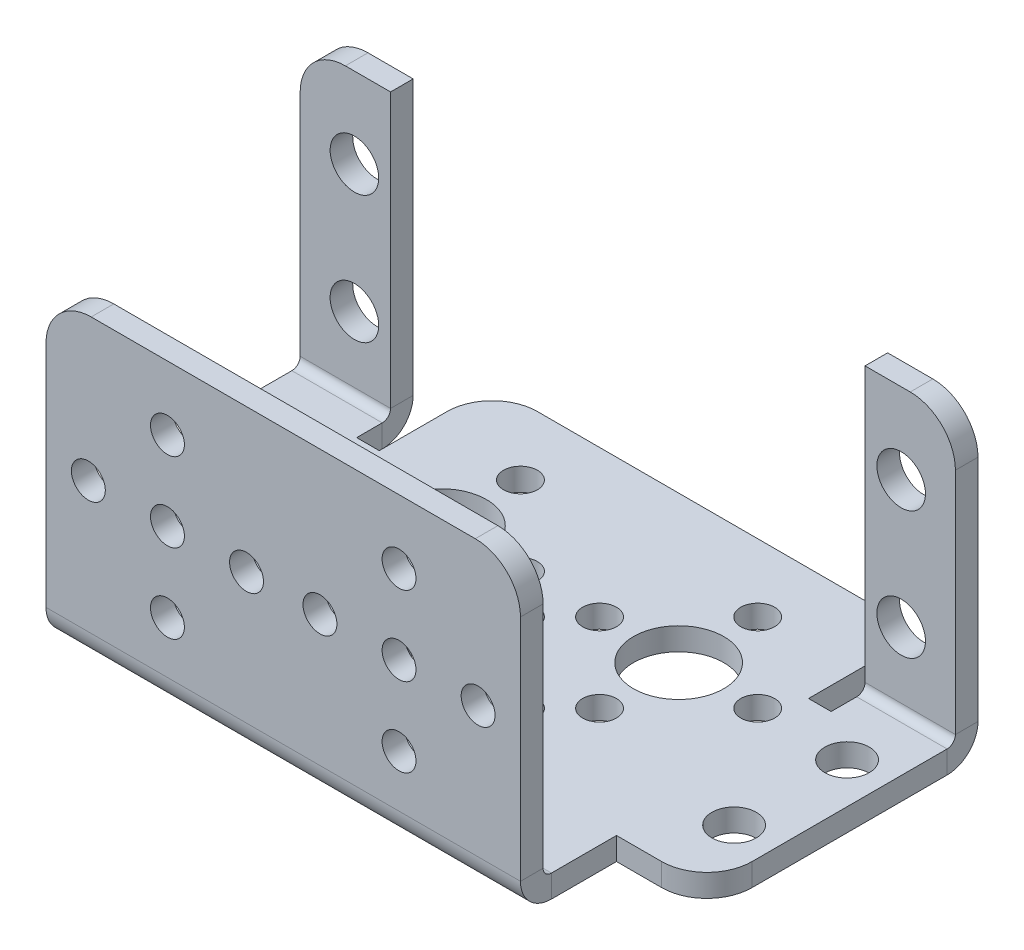
from build123d import *

# Parameters (mm, degrees)
SKETCH2_R                    = 1.9668129
SKETCH2_R_2                  = 4
SKETCH2_R_3                  = 1.5
BASE_FLANGE1_DEPTH           = 2
FILLET1_R                    = 4
EDGE_FLANGE1_STRIP_W         = 9.4732
EDGE_FLANGE1_STRIP_H         = 2
EDGE_FLANGE1_STRIP_CUT_DEPTH = 8
EDGE_FLANGE1_DEPTH           = 8
EDGE_FLANGE2_STRIP_W         = 9.4732
EDGE_FLANGE2_STRIP_H         = 2
EDGE_FLANGE2_STRIP_CUT_DEPTH = 8
EDGE_FLANGE2_DEPTH           = 8
EDGE_FLANGE3_STRIP_W         = 9.4732
EDGE_FLANGE3_STRIP_H         = 2
EDGE_FLANGE3_STRIP_CUT_DEPTH = 42
EDGE_FLANGE3_DEPTH           = 42
FILLET2_R                    = 4
FILLET3_R                    = 4
SKETCH16_R                   = 2.15
SKETCH16_R_2                 = 1.5
CUT_EXTRUDE1_DEPTH           = 54.593376456


# Sheet-metal steps are written as plain solids
with BuildPart() as part:
    # Sketch2 → Base-Flange1 (new body)
    with BuildSketch(Plane(origin=(0, 0, 0), x_dir=(1, 0, 0), z_dir=(0, 1, 0))):
        Polygon((-21, 12.815864023), (-29, 12.815864023), (-29, -9.184135977), (-21, -9.184135977), (-21, -15.684135977), (21, -15.684135977), (21, -9.184135977), (29, -9.184135977), (29, 12.815864023), (21, 12.815864023), (21, 9.815864023), (19, 9.815864023), (19, 19.815864023), (-19, 19.815864023), (-19, 9.815864023), (-21, 9.815864023), align=None)
        with Locations(Location((-25, -3.184135977, 0), (0, 0, 270))):
            Circle(SKETCH2_R, mode=Mode.SUBTRACT)
        with Locations(Location((-25, 6.815864023, 0), (0, 0, 270))):
            Circle(SKETCH2_R, mode=Mode.SUBTRACT)
        with Locations(Location((25.409668555, 6.815864023, 0), (0, 0, 270))):
            Circle(SKETCH2_R, mode=Mode.SUBTRACT)
        with Locations(Location((25.409668555, -3.184135977, 0), (0, 0, 270))):
            Circle(SKETCH2_R, mode=Mode.SUBTRACT)
        with Locations(Location((-10.5, 6.815864023, 0), (0, 0, 270))):
            Circle(SKETCH2_R_2, mode=Mode.SUBTRACT)
        with Locations(Location((10.5, 6.815864023, 0), (0, 0, 270))):
            Circle(SKETCH2_R_2, mode=Mode.SUBTRACT)
        with Locations(Location((0, -3.684135977, 0), (0, 0, 270))):
            Circle(SKETCH2_R_2, mode=Mode.SUBTRACT)
        with Locations(Location((-10.5, 13.815864023, 0), (0, 0, 270))):
            Circle(SKETCH2_R_3, mode=Mode.SUBTRACT)
        with Locations(Location((10.5, 13.815864023, 0), (0, 0, 270))):
            Circle(SKETCH2_R_3, mode=Mode.SUBTRACT)
        with Locations(Location((0, -10.684135977, 0), (0, 0, 270))):
            Circle(SKETCH2_R_3, mode=Mode.SUBTRACT)
        with Locations(Location((-3.5, 6.815864023, 0), (0, 0, 270))):
            Circle(SKETCH2_R_3, mode=Mode.SUBTRACT)
        with Locations(Location((-10.5, -0.184135977, 0), (0, 0, 270))):
            Circle(SKETCH2_R_3, mode=Mode.SUBTRACT)
        with Locations(Location((-17.5, 6.815864023, 0), (0, 0, 270))):
            Circle(SKETCH2_R_3, mode=Mode.SUBTRACT)
        with Locations(Location((17.5, 6.815864023, 0), (0, 0, 270))):
            Circle(SKETCH2_R_3, mode=Mode.SUBTRACT)
        with Locations(Location((10.5, -0.184135977, 0), (0, 0, 270))):
            Circle(SKETCH2_R_3, mode=Mode.SUBTRACT)
        with Locations(Location((3.5, 6.815864023, 0), (0, 0, 270))):
            Circle(SKETCH2_R_3, mode=Mode.SUBTRACT)
        with Locations(Location((-7, -3.684135977, 0), (0, 0, 270))):
            Circle(SKETCH2_R_3, mode=Mode.SUBTRACT)
        with Locations(Location((0, 3.315864023, 0), (0, 0, 270))):
            Circle(SKETCH2_R_3, mode=Mode.SUBTRACT)
        with Locations(Location((7, -3.684135977, 0), (0, 0, 270))):
            Circle(SKETCH2_R_3, mode=Mode.SUBTRACT)
    extrude(amount=-BASE_FLANGE1_DEPTH)

    # Fillet1
    fillet1_edges = [part.edges().sort_by_distance(p)[0] for p in [
        (-19, -1, -19.815864023),
        (19, -1, -19.815864023),
        (29, -1, 9.184135977),
        (-29, -1, 9.184135977),
    ]]
    fillet(fillet1_edges, radius=FILLET1_R)

    # Edge-Flange1 strip (across the edge) → Edge-Flange1 strip cut (cut)
    with BuildSketch(Plane(origin=(-21, 0, -12.815864023), x_dir=(0, 0, 1), z_dir=(-1, 0, 0))):
        with Locations((-4, -1)):
            Rectangle(EDGE_FLANGE1_STRIP_W, EDGE_FLANGE1_STRIP_H)
    extrude(amount=EDGE_FLANGE1_STRIP_CUT_DEPTH, mode=Mode.SUBTRACT)

    # Edge-Flange1 section (across the edge) → Edge-Flange1 (add)
    with BuildSketch(Plane(origin=(-21, 0, -12.815864023), x_dir=(0, 0, 1), z_dir=(-1, 0, 0))):
        with BuildLine():
            Line((-2, 0.7366), (-2, 25))
            Line((-2, 25), (0, 25))
            Line((0, 25), (0, 0.7366))
            ThreePointArc((0, 0.7366), (0.215745145, 0.215745145), (0.7366, 0))
            Line((0.7366, 0), (0.7366, -2))
            ThreePointArc((0.7366, -2), (-1.198468417, -1.198468417), (-2, 0.7366))
        make_face()
    extrude(amount=EDGE_FLANGE1_DEPTH)

    # Edge-Flange2 strip (across the edge) → Edge-Flange2 strip cut (cut)
    with BuildSketch(Plane(origin=(29, 0, -12.815864023), x_dir=(0, 0, 1), z_dir=(-1, 0, 0))):
        with Locations((-4, -1)):
            Rectangle(EDGE_FLANGE2_STRIP_W, EDGE_FLANGE2_STRIP_H)
    extrude(amount=EDGE_FLANGE2_STRIP_CUT_DEPTH, mode=Mode.SUBTRACT)

    # Edge-Flange2 section (across the edge) → Edge-Flange2 (add)
    with BuildSketch(Plane(origin=(29, 0, -12.815864023), x_dir=(0, 0, 1), z_dir=(-1, 0, 0))):
        with BuildLine():
            Line((-2, 0.7366), (-2, 25))
            Line((-2, 25), (0, 25))
            Line((0, 25), (0, 0.7366))
            ThreePointArc((0, 0.7366), (0.215745145, 0.215745145), (0.7366, 0))
            Line((0.7366, 0), (0.7366, -2))
            ThreePointArc((0.7366, -2), (-1.198468417, -1.198468417), (-2, 0.7366))
        make_face()
    extrude(amount=EDGE_FLANGE2_DEPTH)

    # Edge-Flange3 strip (across the edge) → Edge-Flange3 strip cut (cut)
    with BuildSketch(Plane(origin=(-21, 0, 15.684135977), x_dir=(0, 0, -1), z_dir=(1, 0, 0))):
        with Locations((-4, -1)):
            Rectangle(EDGE_FLANGE3_STRIP_W, EDGE_FLANGE3_STRIP_H)
    extrude(amount=EDGE_FLANGE3_STRIP_CUT_DEPTH, mode=Mode.SUBTRACT)

    # Edge-Flange3 section (across the edge) → Edge-Flange3 (add)
    with BuildSketch(Plane(origin=(-21, 0, 15.684135977), x_dir=(0, 0, -1), z_dir=(1, 0, 0))):
        with BuildLine():
            Line((-2, 0.7366), (-2, 25))
            Line((-2, 25), (0, 25))
            Line((0, 25), (0, 0.7366))
            ThreePointArc((0, 0.7366), (0.215745145, 0.215745145), (0.7366, 0))
            Line((0.7366, 0), (0.7366, -2))
            ThreePointArc((0.7366, -2), (-1.198468417, -1.198468417), (-2, 0.7366))
        make_face()
    extrude(amount=EDGE_FLANGE3_DEPTH)

    # Fillet2
    fillet2_edges = [part.edges().sort_by_distance(p)[0] for p in [
        (-29, 25, -13.815864023),
        (29, 25, -13.815864023),
    ]]
    fillet(fillet2_edges, radius=FILLET2_R)

    # Fillet3
    fillet3_edges = [part.edges().sort_by_distance(p)[0] for p in [
        (-21, 25, 16.684135977),
        (21, 25, 16.684135977),
    ]]
    fillet(fillet3_edges, radius=FILLET3_R)

    # Sketch16 → Cut-Extrude1 (cut, through all)
    with BuildSketch(Plane.XY.offset(17.684135977)):
        with Locations(Location((-24.2, 17.870640786, 0), (0, 0, 270))):
            Circle(SKETCH16_R)
        with Locations(Location((24.2, 17.870640786, 0), (0, 0, 270))):
            Circle(SKETCH16_R)
        with Locations(Location((-24.2, 6.570640786, 0), (0, 0, 270))):
            Circle(SKETCH16_R)
        with Locations(Location((24.2, 6.570640786, 0), (0, 0, 270))):
            Circle(SKETCH16_R)
        with Locations((-10.25, 12.330953146)):
            Circle(SKETCH16_R_2)
        with Locations((-10.25, 5.330953146)):
            Circle(SKETCH16_R_2)
        with Locations((10.25, 12.330953146)):
            Circle(SKETCH16_R_2)
        with Locations((10.25, 5.330953146)):
            Circle(SKETCH16_R_2)
        with Locations((-17.25, 12.330953146)):
            Circle(SKETCH16_R_2)
        with Locations((-10.25, 19.330953146)):
            Circle(SKETCH16_R_2)
        with Locations((-3.25, 12.330953146)):
            Circle(SKETCH16_R_2)
        with Locations((3.25, 12.330953146)):
            Circle(SKETCH16_R_2)
        with Locations((10.25, 19.330953146)):
            Circle(SKETCH16_R_2)
        with Locations((17.25, 12.330953146)):
            Circle(SKETCH16_R_2)
    extrude(amount=-CUT_EXTRUDE1_DEPTH, mode=Mode.SUBTRACT)


solid = part.part
